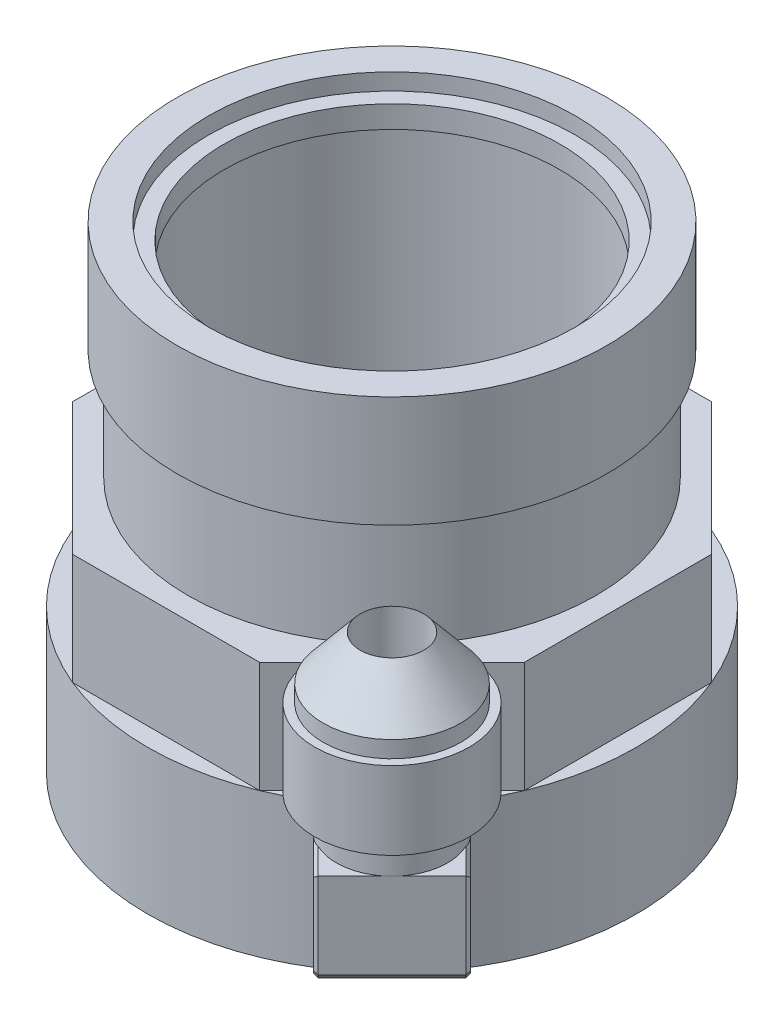
from build123d import *

# Parameters (mm, degrees)
SKETCH_1_R                = 22
EXTRUDE_1_DEPTH           = 43
SKETCH_3_OUTSIDE_W        = 61.128
SKETCH_3_OUTSIDE_H        = 61.128
CUT_EXTRUDE_1_DEPTH       = 30
SKETCH_4_OUTSIDE_W        = 61.128
SKETCH_4_OUTSIDE_H        = 61.128
SKETCH_4_OUTSIDE_R        = 18.35
CUT_EXTRUDE_2_DEPTH       = 20
SKETCH_5_R                = 16.5
CUT_EXTRUDE_3_DEPTH       = 1.5
SKETCH_6_R                = 15.1
CUT_EXTRUDE_4_DEPTH       = 54.075418039
SKETCH_7_R                = 16.5
CUT_EXTRUDE_5_DEPTH       = 27
SKETCH_8_R                = 16.65
CUT_EXTRUDE_6_DEPTH       = 10.5
M39X2_02_D                = 37
M39X2_02_DEPTH            = 9
M39X2_02_TIP              = 11.115921452
SKETCH_14_R               = 3.95
EXTRUDE_2_DEPTH           = 9.6
SKETCH_15_W               = 10
SKETCH_15_H               = 8.5
EXTRUDE_3_DEPTH           = 12
CHAMFER_1_SIZE            = 0.8
CHAMFER_2_SIZE            = 0.3
SKETCH_18_R               = 5
EXTRUDE_4_DEPTH           = 3
CHAMFER_3_SIZE            = 0.3
SKETCH_19_R               = 6.95
EXTRUDE_5_DEPTH           = 7
SKETCH_21_R               = 6.2
EXTRUDE_6_DEPTH           = 1.5
SKETCH_24_R               = 2.85
CUT_EXTRUDE_7_DEPTH       = 22.5
CUT_EXTRUDE_11_REACH      = 69.044
CUT_EXTRUDE_11_END_RADIUS = 2.85
SKETCH_25_R               = 2.85
CUT_EXTRUDE_12_REACH      = 69.044
SKETCH_26_R               = 2.85
SKETCH_27_W               = 1
SKETCH_27_H               = 10


with BuildPart() as part:
    # Эскиз1 → Бобышка-Вытянуть1 (new body)
    with BuildSketch(Plane(origin=(0, 0, 0), x_dir=(1, 0, 0), z_dir=(0, 1, 0))):
        with Locations(Location((0, 0, 0), (0, 0, 270))):
            Circle(SKETCH_1_R)
    extrude(amount=EXTRUDE_1_DEPTH)

    # Эскиз3 outside → Вырез-Вытянуть1 (cut)
    with BuildSketch(Plane(origin=(0, 43, 0), x_dir=(1, 0, 0), z_dir=(0, 1, 0))):
        Rectangle(SKETCH_3_OUTSIDE_W, SKETCH_3_OUTSIDE_H)
        Polygon((20.325349715, -8.419035512), (20.325349715, 8.419035512), (8.419035512, 20.325349715), (-8.419035512, 20.325349715), (-20.325349715, 8.419035512), (-20.325349715, -8.419035512), (-8.419035512, -20.325349715), (8.419035512, -20.325349715), align=None, mode=Mode.SUBTRACT)
    extrude(amount=-CUT_EXTRUDE_1_DEPTH, mode=Mode.SUBTRACT)

    # Эскиз4 outside → Вырез-Вытянуть2 (cut)
    with BuildSketch(Plane(origin=(0, 43, 0), x_dir=(1, 0, 0), z_dir=(0, 1, 0))):
        Rectangle(SKETCH_4_OUTSIDE_W, SKETCH_4_OUTSIDE_H)
        with Locations(Location((0, 0, 0), (0, 0, 270))):
            Circle(SKETCH_4_OUTSIDE_R, mode=Mode.SUBTRACT)
    extrude(amount=-CUT_EXTRUDE_2_DEPTH, mode=Mode.SUBTRACT)

    # Эскиз5 → Вырез-Вытянуть3 (cut)
    with BuildSketch(Plane(origin=(0, 43, 0), x_dir=(1, 0, 0), z_dir=(0, 1, 0))):
        with Locations(Location((0, 0, 0), (0, 0, 270))):
            Circle(SKETCH_5_R)
    extrude(amount=-CUT_EXTRUDE_3_DEPTH, mode=Mode.SUBTRACT)

    # Эскиз6 → Вырез-Вытянуть4 (cut, through all)
    with BuildSketch(Plane(origin=(0, 43, 0), x_dir=(1, 0, 0), z_dir=(0, 1, 0))):
        with Locations(Location((0, 0, 0), (0, 0, 270))):
            Circle(SKETCH_6_R)
    extrude(amount=-CUT_EXTRUDE_4_DEPTH, mode=Mode.SUBTRACT)

    # Эскиз7 → Вырез-Вытянуть5 (cut)
    with BuildSketch(Plane(origin=(0, 39.5, 0), x_dir=(1, 0, 0), z_dir=(0, 1, 0))):
        with Locations(Location((0, 0, 0), (0, 0, 270))):
            Circle(SKETCH_7_R)
    extrude(amount=-CUT_EXTRUDE_5_DEPTH, mode=Mode.SUBTRACT)

    # Эскиз8 → Вырез-Вытянуть6 (cut)
    with BuildSketch(Plane.XZ):
        with Locations(Location((0, 0, 0), (0, 0, 270))):
            Circle(SKETCH_8_R)
    extrude(amount=-CUT_EXTRUDE_6_DEPTH, mode=Mode.SUBTRACT)

    # Отверстие обработанное метчиком M39x2.02
    with Locations(Plane(origin=(0, 0, 0), x_dir=(-1, 0, 0), z_dir=(0, -1, 0))):
        with Locations((0, 0)):
            Hole(M39X2_02_D / 2, depth=M39X2_02_DEPTH)
            with Locations((0, 0, -(M39X2_02_DEPTH + M39X2_02_TIP / 2))):  # 118° drill point
                Cone(0, M39X2_02_D / 2, M39X2_02_TIP, mode=Mode.SUBTRACT)

    # Эскиз14 → Бобышка-Вытянуть2 (add)
    with BuildSketch(Plane(origin=(14.372192614, 0, 14.372192614), x_dir=(0.7071067811865475, 0, -0.7071067811865476), z_dir=(0.7071067811865476, 0, 0.7071067811865475))):
        with Locations((0, 17.35)):
            Circle(SKETCH_14_R)
    extrude(amount=EXTRUDE_2_DEPTH)

    # Эскиз15 → Бобышка-Вытянуть3 (add)
    with BuildSketch(Plane(origin=(21.160417713, 0, 21.160417713), x_dir=(0.7071067811865475, 0, -0.7071067811865476), z_dir=(0.7071067811865476, 0, 0.7071067811865475))):
        with Locations((0, 17.35)):
            Rectangle(SKETCH_15_W, SKETCH_15_H)
    extrude(amount=EXTRUDE_3_DEPTH)

    # Фаска1
    chamfer_1_edges = [part.edges().sort_by_distance(p)[0] for p in [
        (29.645699087, 13.1, 29.645699087),
    ]]
    chamfer(chamfer_1_edges, length=CHAMFER_1_SIZE)

    # Фаска2
    chamfer_2_edges = [part.edges().sort_by_distance(p)[0] for p in [
        (26.110165181, 17.75, 33.181232993),
        (33.181232993, 17.75, 26.110165181),
        (28.655749594, 13.1, 21.584681782),
        (32.898390281, 13.5, 25.827322469),
        (21.584681782, 13.1, 28.655749594),
        (25.827322469, 13.5, 32.898390281),
    ]]
    chamfer(chamfer_2_edges, length=CHAMFER_2_SIZE)

    # Эскиз18 → Бобышка-Вытянуть4 (add)
    with BuildSketch(Plane(origin=(0, 21.6, 0), x_dir=(1, 0, 0), z_dir=(0, 1, 0))):
        with Locations(Location((26.110165181, -26.110165181, 0), (0, 0, 45))):
            Circle(SKETCH_18_R)
    extrude(amount=EXTRUDE_4_DEPTH)

    # Фаска3
    # the kernel refuses this chamfer: 0.3 mm, written as the material it takes off along each edge
    with BuildSketch(Plane(origin=(24.150415275, 21.6, 17.079347463), x_dir=(0.01944252080601493, -0.9996219169112965, -0.019442520806014937), z_dir=(0.7071067811865476, 0, 0.7071067811865475))) as chamfer_3_piece_1_section:
        Polygon((CHAMFER_3_SIZE * 0.999621916911, -CHAMFER_3_SIZE * 0.0274958766106), (-CHAMFER_3_SIZE * 0.0274958766106, -CHAMFER_3_SIZE * 0.999621916911), (0, 0), align=None)
    chamfer_3_piece_1 = extrude(amount=7.771504896, mode=Mode.PRIVATE)
    chamfer_3_piece_1 = chamfer_3_piece_1 - Plane(origin=(26.110165181, 21.497863029, 26.110165181), x_dir=(0.7071067811865476, 0, -0.7071067811865475), z_dir=(0, -1, 0)) * Cylinder(5, 17, mode=Mode.PRIVATE)
    add(chamfer_3_piece_1, mode=Mode.SUBTRACT)
    with BuildSketch(Plane(origin=(29.645699087, 21.6, 22.574631275), x_dir=(0.01944252080600918, -0.999621916911297, -0.019442520806009188), z_dir=(0.7071067811865476, 0, 0.7071067811865475))) as chamfer_3_piece_2_section:
        Polygon((CHAMFER_3_SIZE * 0.999621916911, -CHAMFER_3_SIZE * 0.0274958766106), (-CHAMFER_3_SIZE * 0.0274958766106, -CHAMFER_3_SIZE * 0.999621916911), (0, 0), align=None)
    chamfer_3_piece_2 = extrude(amount=5.471504896, mode=Mode.PRIVATE)
    chamfer_3_piece_2 = chamfer_3_piece_2 - Plane(origin=(26.110165181, 21.497295997, 26.110165181), x_dir=(0.7071067811865476, 0, -0.7071067811865475), z_dir=(0, -1, 0)) * Cylinder(5, 13, mode=Mode.PRIVATE)
    add(chamfer_3_piece_2, mode=Mode.SUBTRACT)
    with BuildSketch(Plane(origin=(17.079347463, 21.6, 24.150415275), x_dir=(-0.01944252080601493, -0.9996219169112965, 0.019442520806014937), z_dir=(0.7071067811865476, 0, 0.7071067811865475))) as chamfer_3_piece_3_section:
        Polygon((CHAMFER_3_SIZE * 0.999621916911, CHAMFER_3_SIZE * 0.0274958766106), (-CHAMFER_3_SIZE * 0.0274958766106, CHAMFER_3_SIZE * 0.999621916911), (0, 0), align=None)
    chamfer_3_piece_3 = extrude(amount=7.771504896, mode=Mode.PRIVATE)
    chamfer_3_piece_3 = chamfer_3_piece_3 - Plane(origin=(26.110165181, 21.497863029, 26.110165181), x_dir=(0.7071067811865476, 0, -0.7071067811865475), z_dir=(0, -1, 0)) * Cylinder(5, 17, mode=Mode.PRIVATE)
    add(chamfer_3_piece_3, mode=Mode.SUBTRACT)
    with BuildSketch(Plane(origin=(22.574631275, 21.6, 29.645699087), x_dir=(-0.01944252080602069, -0.9996219169112965, 0.01944252080602069), z_dir=(0.7071067811865476, 0, 0.7071067811865475))) as chamfer_3_piece_4_section:
        Polygon((CHAMFER_3_SIZE * 0.999621916911, CHAMFER_3_SIZE * 0.0274958766106), (-CHAMFER_3_SIZE * 0.0274958766106, CHAMFER_3_SIZE * 0.999621916911), (0, 0), align=None)
    chamfer_3_piece_4 = extrude(amount=5.471504896, mode=Mode.PRIVATE)
    chamfer_3_piece_4 = chamfer_3_piece_4 - Plane(origin=(26.110165181, 21.497295996, 26.110165181), x_dir=(0.7071067811865476, 0, -0.7071067811865475), z_dir=(0, -1, 0)) * Cylinder(5, 13, mode=Mode.PRIVATE)
    add(chamfer_3_piece_4, mode=Mode.SUBTRACT)

    # Эскиз19 → Бобышка-Вытянуть5 (add)
    with BuildSketch(Plane(origin=(0, 24.6, 0), x_dir=(1, 0, 0), z_dir=(0, 1, 0))):
        with Locations(Location((26.110165181, -26.110165181, 0), (0, 0, 270))):
            Circle(SKETCH_19_R)
    extrude(amount=EXTRUDE_5_DEPTH)

    # Эскиз21 → Бобышка-Вытянуть6 (add)
    with BuildSketch(Plane(origin=(0, 31.6, 0), x_dir=(1, 0, 0), z_dir=(0, 1, 0))):
        with Locations(Location((26.110165181, -26.110165181, 0), (0, 0, 270))):
            Circle(SKETCH_21_R)
    extrude(amount=EXTRUDE_6_DEPTH)

    # Эскиз22 → Повернуть1 (revolve)
    with BuildSketch(Plane(origin=(0, 0, 0), x_dir=(0.7071067811865477, 0, 0.7071067811865475), z_dir=(-0.7071067811865475, 0, 0.7071067811865477)), mode=Mode.PRIVATE) as revolve_1_sk:
        Polygon((36.925349715, 33.1), (36.925349715, 37.1), (39.775349715, 37.1), (43.125349715, 33.1), align=None)
    revolve(revolve_1_sk.sketch.rotate(Axis((26.110165181, -966.9, 26.110165181), (0, 1, 0)), 109.948443589), axis=Axis((26.110165181, -966.9, 26.110165181), (0, 1, 0)))

    # Эскиз24 → Вырез-Вытянуть7 (cut)
    with BuildSketch(Plane(origin=(0, 37.1, 0), x_dir=(1, 0, 0), z_dir=(0, 1, 0))):
        with Locations(Location((26.110165181, -26.110165181, 0), (0, 0, 270))):
            Circle(SKETCH_24_R)
    extrude(amount=-CUT_EXTRUDE_7_DEPTH, mode=Mode.SUBTRACT)

    # Вырез-Вытянуть11: up to this cylinder (the profile starts outside it)
    cut_extrude_11_end = Plane(origin=(26.110165181, 17.35, 26.110165181), z_dir=(0, 1, 0)) * Cylinder(CUT_EXTRUDE_11_END_RADIUS, 144.788, mode=Mode.PRIVATE)
    # Эскиз25 → Вырез-Вытянуть11 (cut, up to the surface)
    with BuildSketch(Plane(origin=(14.372192614, 0, 14.372192614), x_dir=(0.7071067811865475, 0, -0.7071067811865476), z_dir=(0.7071067811865476, 0, 0.7071067811865475)), mode=Mode.PRIVATE) as cut_extrude_11_sk1:
        with Locations((0, 17.35)):
            Circle(SKETCH_25_R)
    cut_extrude_11_tool1 = extrude(cut_extrude_11_sk1.sketch, amount=CUT_EXTRUDE_11_REACH, mode=Mode.PRIVATE) - cut_extrude_11_end
    add(cut_extrude_11_tool1.solids().sort_by_distance((14.372193, 17.35, 14.372193))[0], mode=Mode.SUBTRACT)

    # Эскиз26 → Вырез-Вытянуть12 (cut, up to next)
    with BuildSketch(Plane(origin=(14.372192614, 0, 14.372192614), x_dir=(0.7071067811865475, 0, -0.7071067811865476), z_dir=(0.7071067811865476, 0, 0.7071067811865475)), mode=Mode.PRIVATE) as cut_extrude_12_sk1:
        with Locations((0, 17.35)):
            Circle(SKETCH_26_R)
    cut_extrude_12_tool1 = extrude(cut_extrude_12_sk1.sketch, amount=-CUT_EXTRUDE_12_REACH, mode=Mode.PRIVATE) & part.part
    add(cut_extrude_12_tool1.solids().sort_by_distance((14.372193, 17.35, 14.372193))[0], mode=Mode.SUBTRACT)

    # Эскиз27 → Повернуть2 (revolve)
    with BuildSketch(Plane(origin=(0, 0, 0), x_dir=(0.7071067811865477, 0, 0.7071067811865475), z_dir=(-0.7071067811865475, 0, 0.7071067811865477)), mode=Mode.PRIVATE) as revolve_2_sk:
        with Locations((18.85, 38)):
            Rectangle(SKETCH_27_W, SKETCH_27_H)
    revolve(revolve_2_sk.sketch.rotate(Axis((0, 12.5, 0), (0, 1, 0)), 135), axis=Axis((0, 12.5, 0), (0, 1, 0)))


solid = part.part
